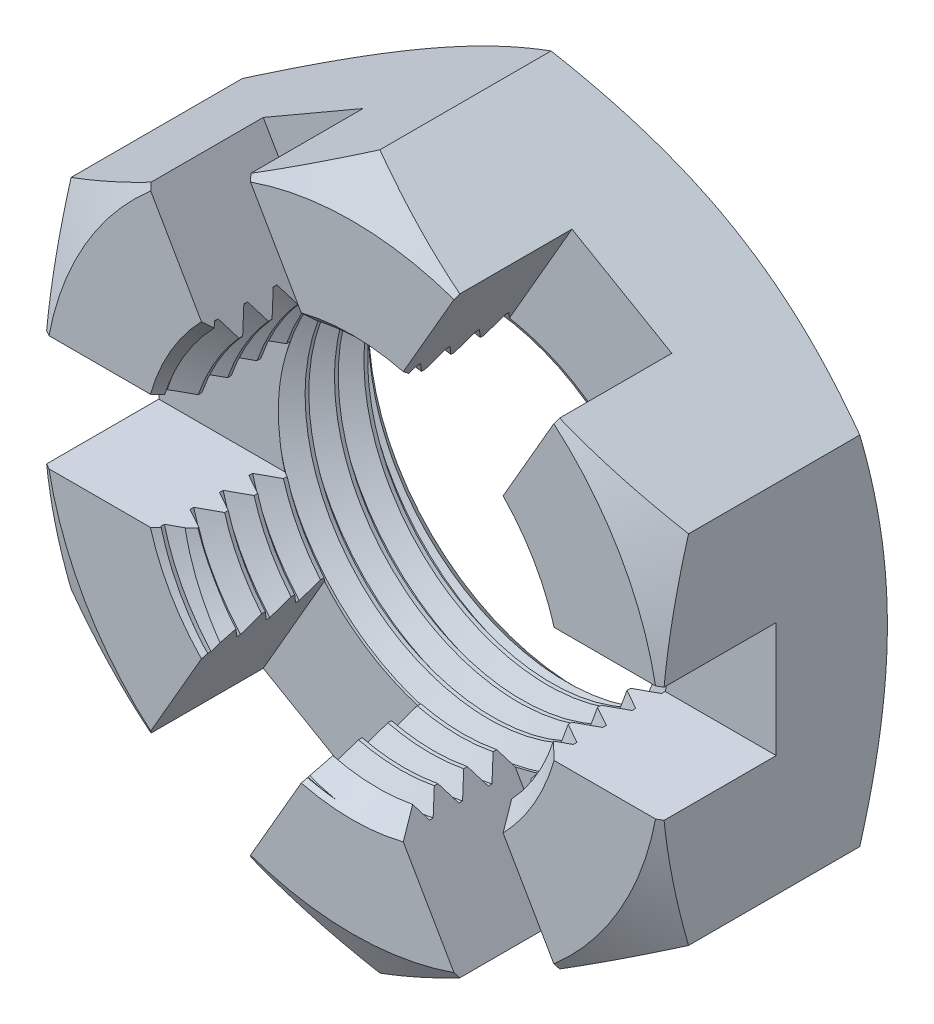
from build123d import *

# Parameters (mm, degrees)
EXTRUDE1_DEPTH     = 13.97
SKETCH2_OUTSIDE_W  = 167.352
SKETCH2_OUTSIDE_H  = 173.246
SKETCH2_OUTSIDE_R  = 19.05
CUT_EXTRUDE1_DEPTH = 33.278993169
CUT_EXTRUDE1_DRAFT = -60
SKETCH3_OUTSIDE_W  = 167.352
SKETCH3_OUTSIDE_H  = 173.246
SKETCH3_OUTSIDE_R  = 19.05
CUT_EXTRUDE2_DEPTH = 33.278993169
CUT_EXTRUDE2_DRAFT = -60
SKETCH4_R          = 12.7
CUT_EXTRUDE3_DEPTH = 33.278993169
SKETCH12_R         = 12.7
SKETCH12_R_2       = 11.521586861
EXTRUDE2_DEPTH     = 13.97
CUT_SWEEP1_PITCH   = 1.814285714
CUT_EXTRUDE8_DEPTH = 7.112
CIRPATTERN1_COUNT  = 6


with BuildPart() as part:
    # Sketch1 → Extrude1 (new body)
    with BuildSketch(Plane.XY):
        Polygon((0, 21.997045256), (-19.05, 10.998522628), (-19.05, -10.998522628), (0, -21.997045256), (19.05, -10.998522628), (19.05, 10.998522628), align=None)
    extrude(amount=-EXTRUDE1_DEPTH)


with BuildPart() as cut_extrude1_tool:
    # Sketch2 outside → Cut-Extrude1 (with draft: the straight prism first)
    with BuildSketch(Plane.XY):
        Rectangle(SKETCH2_OUTSIDE_W, SKETCH2_OUTSIDE_H)
        Circle(SKETCH2_OUTSIDE_R, mode=Mode.SUBTRACT)
    extrude(amount=-CUT_EXTRUDE1_DEPTH)
    # Cut-Extrude1: the draft: its side faces are tilted about the plane it starts from
    cut_extrude1_sides = [cut_extrude1_tool.faces().sort_by_distance(p)[0] for p in [
        (0, -86.623, -16.639496584),
        (83.676, 0, -16.639496584),
        (0, 86.623, -16.639496584),
        (-83.676, 0, -16.639496584),
        (-19.05, 0, -16.639496584),
    ]]
    draft(cut_extrude1_sides, Plane.XY, CUT_EXTRUDE1_DRAFT)


with BuildPart() as part_1:
    add(part.part)

    # Cut-Extrude1: cut by cut_extrude1_tool
    add(cut_extrude1_tool.part, mode=Mode.SUBTRACT)


with BuildPart() as cut_extrude2_tool:
    # Sketch3 outside → Cut-Extrude2 (with draft: the straight prism first)
    with BuildSketch(Plane(origin=(0, 0, -13.97), x_dir=(-1, 0, 0), z_dir=(0, 0, -1))):
        Rectangle(SKETCH3_OUTSIDE_W, SKETCH3_OUTSIDE_H)
        Circle(SKETCH3_OUTSIDE_R, mode=Mode.SUBTRACT)
    extrude(amount=-CUT_EXTRUDE2_DEPTH)
    # Cut-Extrude2: the draft: its side faces are tilted about the plane it starts from
    cut_extrude2_sides = [cut_extrude2_tool.faces().sort_by_distance(p)[0] for p in [
        (0, -86.623, 2.669496584),
        (-83.676, 0, 2.669496584),
        (0, 86.623, 2.669496584),
        (83.676, 0, 2.669496584),
        (19.05, 0, 2.669496584),
    ]]
    draft(cut_extrude2_sides, Plane(origin=(0, 0, -13.97), x_dir=(-1, 0, 0), z_dir=(0, 0, -1)), CUT_EXTRUDE2_DRAFT)


with BuildPart() as part_2:
    add(part_1.part)

    # Cut-Extrude2: cut by cut_extrude2_tool
    add(cut_extrude2_tool.part, mode=Mode.SUBTRACT)

    # Sketch4 → Cut-Extrude3 (cut, through all)
    with BuildSketch(Plane.XY):
        Circle(SKETCH4_R)
    extrude(amount=-CUT_EXTRUDE3_DEPTH, mode=Mode.SUBTRACT)

    # Sketch12 → Extrude2 (add)
    with BuildSketch(Plane.XY):
        Circle(SKETCH12_R)
        Circle(SKETCH12_R_2, mode=Mode.SUBTRACT)
    extrude(amount=-EXTRUDE2_DEPTH)

    # Cut-Sweep1: the profile of Sketch9 profile screwed along a right-hand helix of 8.7 turns, 6 arcs to a turn; built about Z, then put on its axis
    cut_sweep1_z = Axis((0, 0, 0), (0, 0, 1))
    cut_sweep1_corners = [(12.7, 0, -0.907142857), (12.7, 0, -0.680357143), (11.521286861, 0, 0.000173205), (11.521286861, 0, -1.587673205)]
    with BuildLine(mode=Mode.PRIVATE) as cut_sweep1_profile:
        Line(cut_sweep1_corners[0], cut_sweep1_corners[1])
        Line(cut_sweep1_corners[1], cut_sweep1_corners[2])
        Line(cut_sweep1_corners[2], cut_sweep1_corners[3])
        Line(cut_sweep1_corners[3], cut_sweep1_corners[0])
    cut_sweep1_cap = Face(cut_sweep1_profile.wire())
    cut_sweep1_turn_angles = [0, 30, 60, 90, 120, 150, 180, 210, 240, 270, 300, 330, 360]
    cut_sweep1_turn_weights = [1, 0.8660254037844387, 1, 0.8660254037844387, 1, 0.8660254037844387, 1, 0.8660254037844387, 1, 0.8660254037844387, 1, 0.8660254037844387, 1]
    cut_sweep1_turn_rails = [Edge.make_bspline([Vector(p[0], p[1], 0).rotate(cut_sweep1_z, cut_sweep1_turn_angles[k]) / cut_sweep1_turn_weights[k] + Vector(0, 0, p[2] + CUT_SWEEP1_PITCH * cut_sweep1_turn_angles[k] / 360) for k in range(13)], [0, 0, 0, 1, 1, 2, 2, 3, 3, 4, 4, 5, 5, 6, 6, 6], 2, cut_sweep1_turn_weights) for p in cut_sweep1_corners]
    cut_sweep1_turn_sides = [Face.make_surface_from_curves(cut_sweep1_turn_rails[p[0]], cut_sweep1_turn_rails[p[1]]) for p in [(0, 1), (1, 2), (2, 3), (3, 0)]]
    cut_sweep1_last_angles = [2880, 2910, 2940, 2970, 3000, 3030, 3060, 3090, 3120, 3126, 3132]
    cut_sweep1_last_weights = [1, 0.8660254037844387, 1, 0.8660254037844387, 1, 0.8660254037844387, 1, 0.8660254037844387, 1, 0.9945218953682746, 1]
    cut_sweep1_last_rails = [Edge.make_bspline([Vector(p[0], p[1], 0).rotate(cut_sweep1_z, cut_sweep1_last_angles[k]) / cut_sweep1_last_weights[k] + Vector(0, 0, p[2] + CUT_SWEEP1_PITCH * cut_sweep1_last_angles[k] / 360) for k in range(11)], [0, 0, 0, 1, 1, 2, 2, 3, 3, 4, 4, 5, 5, 5], 2, cut_sweep1_last_weights) for p in cut_sweep1_corners]
    cut_sweep1_last_sides = [Face.make_surface_from_curves(cut_sweep1_last_rails[p[0]], cut_sweep1_last_rails[p[1]]) for p in [(0, 1), (1, 2), (2, 3), (3, 0)]]
    cut_sweep1 = Plane(origin=(0, 0, 0), x_dir=(0, 1, 0), z_dir=(0, 0, -1)) * Solid(Shell([*[p.moved(Location((0, 0, CUT_SWEEP1_PITCH * i))) for i in range(8) for p in cut_sweep1_turn_sides], *cut_sweep1_last_sides, cut_sweep1_cap, cut_sweep1_cap.rotate(cut_sweep1_z, 3132).moved(Location((0, 0, CUT_SWEEP1_PITCH * 3132 / 360)))]))
    add(cut_sweep1, mode=Mode.SUBTRACT)

    # Cut-Extrude6 cone 1 section (through the dimple's axis) → Cut-Extrude6 (revolve, cut)
    with BuildSketch(Plane(origin=(0, 0, 0), x_dir=(0, -1, 0), z_dir=(1, 0, 0))):
        Polygon((0, 0), (12.954, 0), (0, 12.954), align=None)
    revolve(axis=Axis((0, 0, 0), (0, 0, -1)), mode=Mode.SUBTRACT)

    # Cut-Extrude7 cone 1 section (through the dimple's axis) → Cut-Extrude7 (revolve, cut)
    with BuildSketch(Plane(origin=(0, 0, -13.97), x_dir=(0, 1, 0), z_dir=(1, 0, 0))):
        Polygon((0, 0), (12.954, 0), (0, 12.954), align=None)
    revolve(axis=Axis((0, 0, -13.97), (0, 0, 1)), mode=Mode.SUBTRACT)

    # Sketch13 → Cut-Extrude8 (cut)
    with BuildSketch(Plane.XY):
        Polygon((-3.079586336, 1.778), (3.079586336, -1.778), (12.604586336, 14.719783942), (6.445413664, 18.275783942), align=None)
    cut_extrude8 = extrude(amount=-CUT_EXTRUDE8_DEPTH, mode=Mode.SUBTRACT)

    # CirPattern1: Cut-Extrude8 ×6 about axis
    cirpattern1_axis = Axis((0, 0, 0), (0, 0, 1))
    for i in range(1, CIRPATTERN1_COUNT):
        add(cut_extrude8.rotate(cirpattern1_axis, i * 360 / CIRPATTERN1_COUNT), mode=Mode.SUBTRACT)


solid = part_2.part
